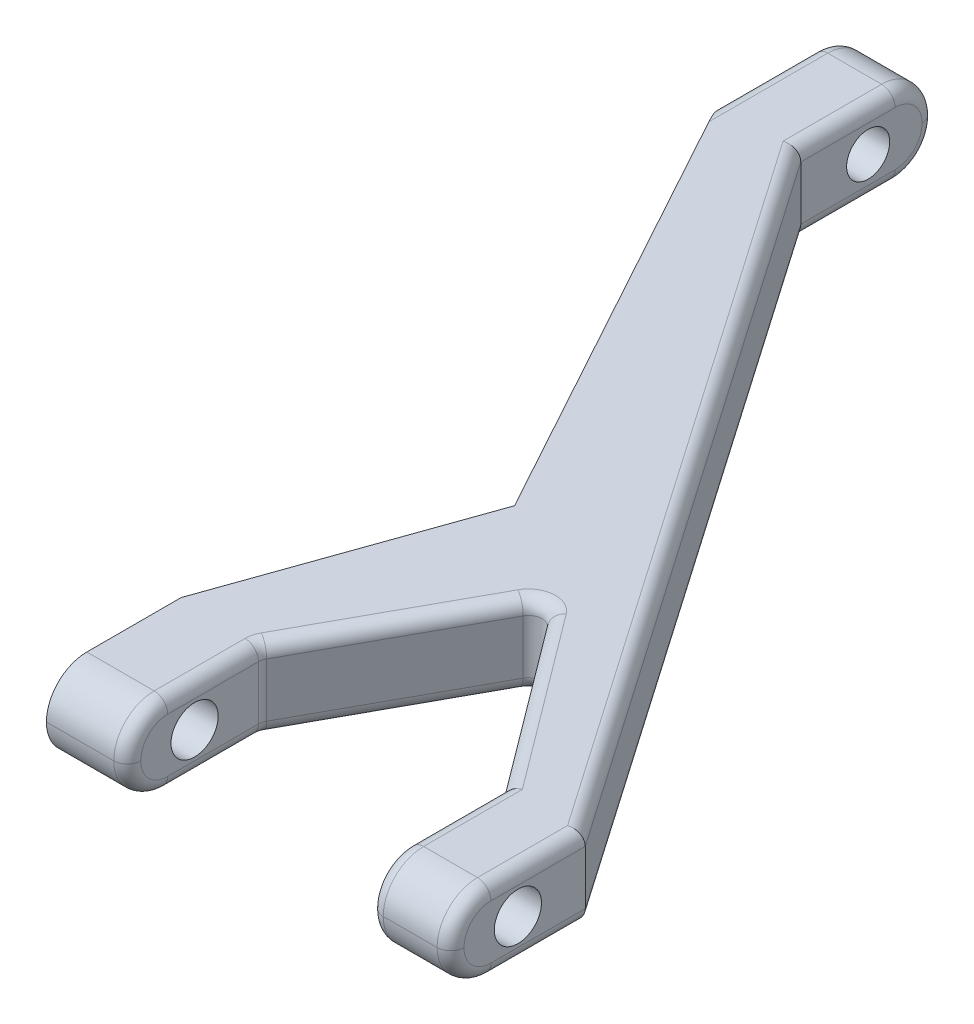
from build123d import *

# Parameters (mm, degrees)
BOSS_EXTRUDE1_DEPTH = 6
SKETCH3_R           = 1.75
CUT_EXTRUDE1_DEPTH  = 84.570329663
SKETCH4_R           = 1.6
CUT_EXTRUDE2_DEPTH  = 81.721744282
FILLET1_R           = 3
FILLET2_R           = 1


with BuildPart() as part:
    # Sketch2 → Boss-Extrude1 (new body)
    with BuildSketch(Plane(origin=(0, 0, 0), x_dir=(1, 0, 0), z_dir=(0, 1, 0))):
        Polygon((6, -72), (12, -72), (12, -62), (19.625958238, -48.121978446), (30, -62), (30, -72), (36, -72), (36, -62), (0, -10), (0, 0), (-6, 0), (-6, -10), (12.471726571, -43.721673541), (6, -62), align=None)
    extrude(amount=BOSS_EXTRUDE1_DEPTH)

    # Sketch3 → Cut-Extrude1 (cut, through all)
    with BuildSketch(Plane(origin=(36, 0, 0), x_dir=(0, 0, -1), z_dir=(1, 0, 0))):
        with Locations((-67, 3)):
            Circle(SKETCH3_R)
    extrude(amount=-CUT_EXTRUDE1_DEPTH, mode=Mode.SUBTRACT)

    # Sketch4 → Cut-Extrude2 (cut, through all)
    with BuildSketch(Plane(origin=(0, 0, 0), x_dir=(0, 0, -1), z_dir=(1, 0, 0))):
        with Locations((-5, 3)):
            Circle(SKETCH4_R)
    extrude(amount=-CUT_EXTRUDE2_DEPTH, mode=Mode.SUBTRACT)

    # Fillet1
    fillet1_edges = [part.edges().sort_by_distance(p)[0] for p in [
        (-3, 0, 0),
        (-3, 6, 0),
        (33, 0, 72),
        (33, 6, 72),
        (9, 0, 72),
        (9, 6, 72),
    ]]
    fillet(fillet1_edges, radius=FILLET1_R - 0.0001)  # a hair under: the kernel refuses the full size

    # Fillet2
    fillet2_edges = [part.edges().sort_by_distance(p)[0] for p in [
        (0, 0, 6.49995),
        (18, 0, 36),
        (30, 0, 65.50005),
        (24.812979119, 0, 55.060989223),
        (15.812979119, 0, 55.060989223),
        (19.625958238, 3, 48.121978446),
        (12, 3, 62),
        (15.812979119, 6, 55.060989223),
        (24.812979119, 6, 55.060989223),
        (30, 6, 65.50005),
        (18, 6, 36),
        (0, 6, 6.49995),
        (-6, 0, 6.49995),
        (-6, 6, 6.49995),
        (-6, 5.121349633, 0.878650367),
        (-6, 0.878650367, 0.878650367),
        (36, 0, 65.50005),
        (12, 0, 65.50005),
        (0, 5.121349633, 0.878650367),
        (0, 0.878650367, 0.878650367),
        (12, 6, 65.50005),
        (36, 6, 65.50005),
        (36, 5.121349633, 71.121349633),
        (36, 0.878650367, 71.121349633),
        (30, 5.121349633, 71.121349633),
        (30, 0.878650367, 71.121349633),
        (12, 5.121349633, 71.121349633),
        (12, 0.878650367, 71.121349633),
    ]]
    fillet(fillet2_edges, radius=FILLET2_R)


solid = part.part
